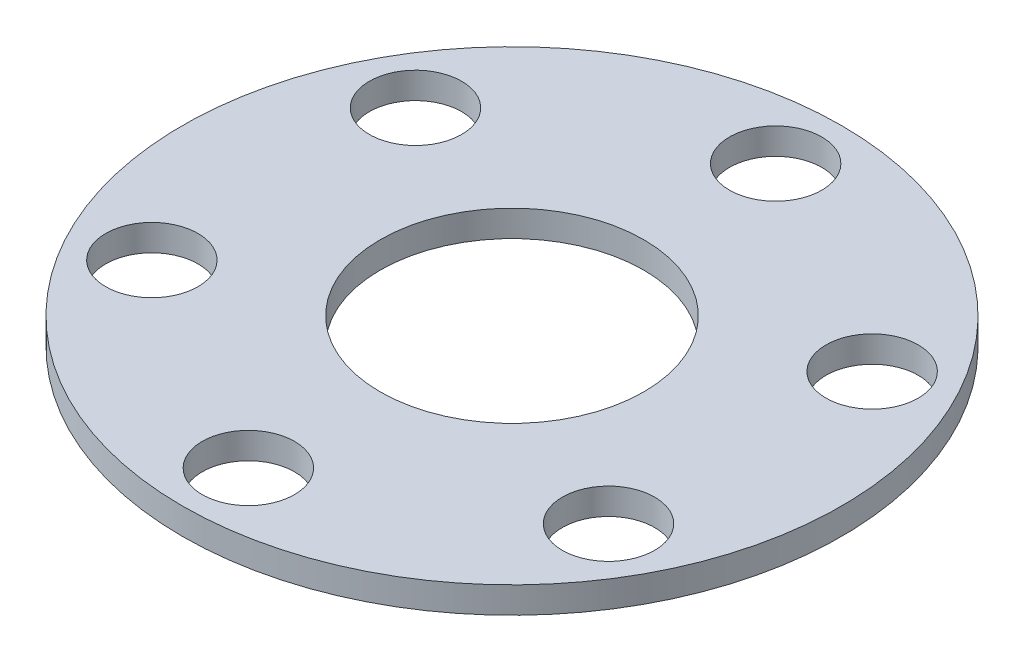
from build123d import *

# Parameters (mm, degrees)
SKETCH1_R           = 12.5
SKETCH1_R_2         = 5
BOSS_EXTRUDE1_DEPTH = 1
SKETCH2_R           = 1.75
CUT_EXTRUDE1_DEPTH  = 18.70593121
CIRPATTERN1_COUNT   = 6


with BuildPart() as part:
    # Sketch1 → Boss-Extrude1 (new body)
    with BuildSketch(Plane(origin=(0, 0, 0), x_dir=(1, 0, 0), z_dir=(0, 1, 0))):
        Circle(SKETCH1_R)
        Circle(SKETCH1_R_2, mode=Mode.SUBTRACT)
    extrude(amount=BOSS_EXTRUDE1_DEPTH)

    # Sketch2 → Cut-Extrude1 (cut, through all)
    with BuildSketch(Plane(origin=(0, 0, 0), x_dir=(1, 0, 0), z_dir=(0, 1, 0))):
        with Locations((0, 10)):
            Circle(SKETCH2_R)
    cut_extrude1 = extrude(amount=CUT_EXTRUDE1_DEPTH, mode=Mode.SUBTRACT)

    # CirPattern1: Cut-Extrude1 ×6 about axis
    cirpattern1_axis = Axis((0, 1, 0), (0, 1, 0))
    for i in range(1, CIRPATTERN1_COUNT):
        add(cut_extrude1.rotate(cirpattern1_axis, i * 360 / CIRPATTERN1_COUNT), mode=Mode.SUBTRACT)


solid = part.part
